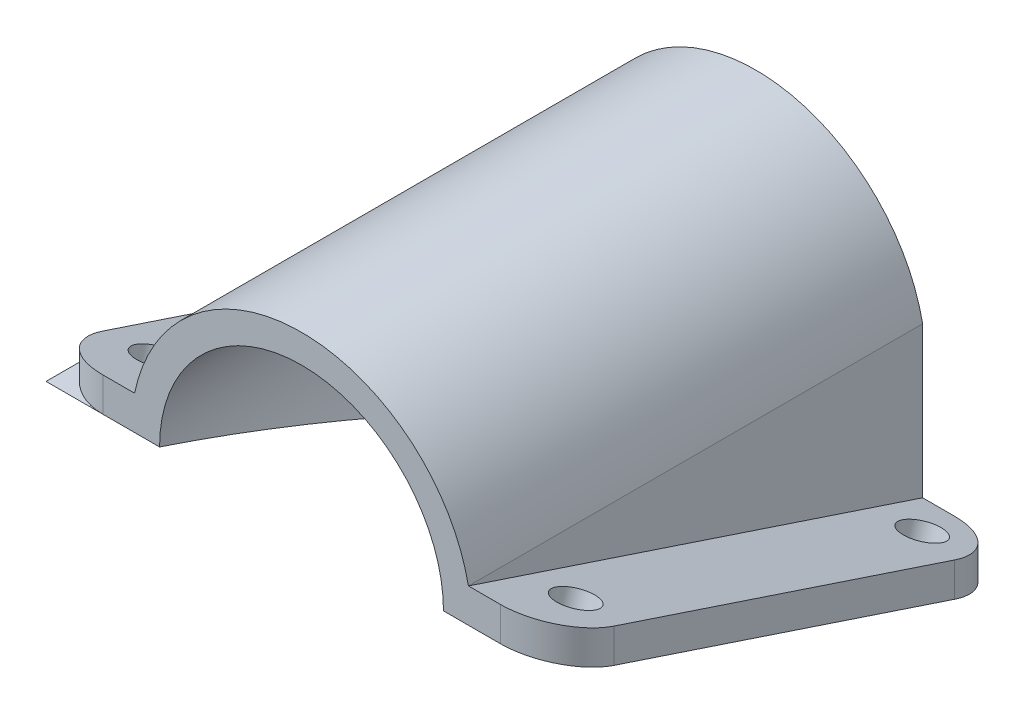
from build123d import *

# Parameters (mm, degrees)
EXTRUDE_1_DEPTH     = 40
EXTRUDE_START       = -45.001
EXTRUDE_2_DEPTH     = 45.001
EXTRUDE_2_2_DEPTH   = 41
SKETCH_4_R          = 1.75
CUT_EXTRUDE_1_DEPTH = 51.311943761
CUT_EXTRUDE_2_DEPTH = 7.803062
CUT_EXTRUDE_3_DEPTH = 7.804062
FILLET_6_R          = 5
FILLET_7_R          = 0.5


with BuildPart() as part:
    # ｽｹｯﾁ1 → ﾎﾞｽ - 押し出し1 (new body)
    with BuildSketch(Plane.XY):
        with BuildLine():
            Line((-14.696938457, 3), (-22.5, 3))
            Line((-22.5, 3), (-22.5, 0))
            Line((-22.5, 0), (-12.5, 0))
            ThreePointArc((-12.5, 0), (0, 12.5), (12.5, 0))
            Line((12.5, 0), (22.5, 0))
            Line((22.5, 0), (22.5, 3))
            Line((22.5, 3), (14.696938457, 3))
            ThreePointArc((14.696938457, 3), (0, 15), (-14.696938457, 3))
        make_face()
    extrude(amount=EXTRUDE_1_DEPTH)

    # ﾎﾞｽ - 押し出し2: read off the stored shape, not the designer's step
    # ﾎﾞｽ - 押し出し2 outline → ﾎﾞｽ - 押し出し2 (add)
    with BuildSketch(Plane(origin=(22.5, 0, 0), x_dir=(0, 0, -1), z_dir=(1, 0, 0)).offset(EXTRUDE_START)):
        Polygon((0, -13.276129684), (0, 0), (-40, 0), align=None)
    extrude(amount=EXTRUDE_2_DEPTH)

    # Extrude 2 2 outline → Extrude 2 2 (cut)
    with BuildSketch(Plane.XY):
        with BuildLine():
            ThreePointArc((-12.5, 0), (0, -12.5), (12.5, 0))
            Line((12.5, 0), (-12.5, 0))
        make_face()
    extrude(amount=EXTRUDE_2_2_DEPTH, mode=Mode.SUBTRACT)

    # ｽｹｯﾁ4 → ｶｯﾄ - 押し出し1 (cut, through all)
    with BuildSketch(Plane(origin=(0, -11.958755971, 3.969149878), x_dir=(-1, 0, 0), z_dir=(0, -0.9490896970518627, 0.31500594748354094))):
        with Locations(Location((18.501, -32.963587882, 0), (0, 0, 90))):
            Circle(SKETCH_4_R)
        with Locations(Location((18.501, -0.81794019, 0), (0, 0, 90))):
            Circle(SKETCH_4_R)
        with Locations(Location((-18.5, -32.963587882, 0), (0, 0, 90))):
            Circle(SKETCH_4_R)
        with Locations(Location((-18.5, -0.81794019, 0), (0, 0, 90))):
            Circle(SKETCH_4_R)
    extrude(amount=-CUT_EXTRUDE_1_DEPTH, mode=Mode.SUBTRACT)

    # ｽｹｯﾁ5 → ｶｯﾄ - 押し出し2 (cut)
    with BuildSketch(Plane(origin=(22.5, 0, 0), x_dir=(0, 0, -1), z_dir=(1, 0, 0))):
        Polygon((-40, 3), (0, -10.276129684), (0, 3.043212606), align=None)
    extrude(amount=-CUT_EXTRUDE_2_DEPTH, mode=Mode.SUBTRACT)

    # ｽｹｯﾁ7 → ｶｯﾄ - 押し出し3 (cut)
    with BuildSketch(Plane.ZY.offset(22.501)):
        Polygon((0, 3), (40, 3), (0, -10.276129684), align=None)
    extrude(amount=-CUT_EXTRUDE_3_DEPTH, mode=Mode.SUBTRACT)

    # ﾌｨﾚｯﾄ6
    fillet_6_edges = [part.edges().sort_by_distance(p)[0] for p in [
        (22.5, -11.776129684, 0),
        (22.5, 1.5, 40),
        (-22.5, 1.5, 40),
        (-22.501, -11.776129684, 0),
    ]]
    fillet(fillet_6_edges, radius=FILLET_6_R)

    # ﾌｨﾚｯﾄ7
    fillet_7_edges = [part.edges().sort_by_distance(p)[0] for p in [
        (12.5, 0, 0),
    ]]
    fillet(fillet_7_edges, radius=FILLET_7_R)


solid = part.part
